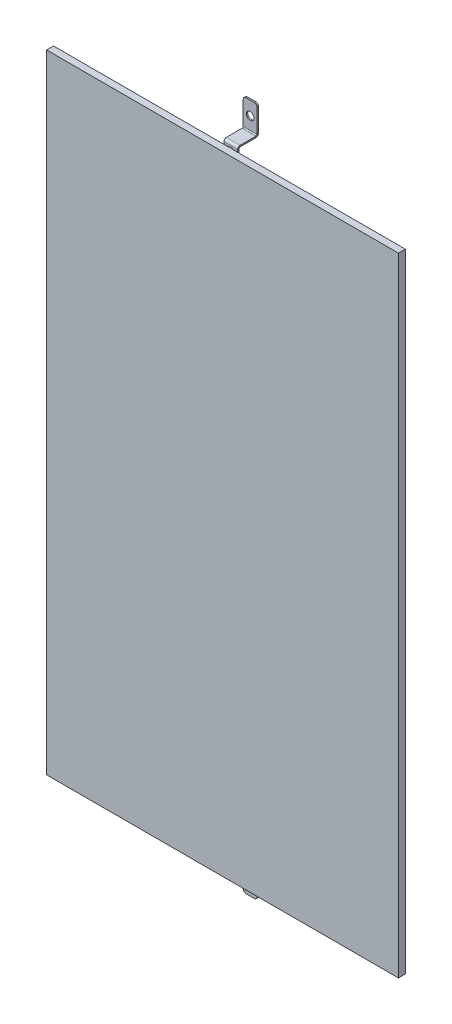
from build123d import *
from build123d.topology import SkipClean

# Parameters (mm, degrees)
SKETCH1_W           = 255
SKETCH1_H           = 455
BOSS_EXTRUDE1_DEPTH = 5
SKETCH2_R           = 2.75
BASE_FLANGE1_DEPTH  = 1
JOG1_START          = 145
JOG1_DEPTH          = 10
JOG1_START_2        = 147
JOG1_2_DEPTH        = 6
JOG1_START_3        = -7.7366
JOG1_3_DEPTH        = 1.716372919
JOG1_START_4        = -20
JOG1_4_OUTLINE_W    = 2
JOG1_4_OUTLINE_H    = 1
JOG1_4_DEPTH        = 12.381759831
JOG1_START_5        = -7
JOG1_5_DEPTH        = 1
JOG1_6_DEPTH        = 10
JOG1_7_DEPTH        = 10
SKETCH8_R           = 4
BOSS_EXTRUDE2_DEPTH = 1


with BuildPart() as part:
    # Sketch1 → Boss-Extrude1 (new body)
    with BuildSketch(Plane.XY):
        with Locations((150, 250)):
            Rectangle(SKETCH1_W, SKETCH1_H)
    extrude(amount=-BOSS_EXTRUDE1_DEPTH)


with BuildPart() as body_2:
    # Base-Flange1: sheet metal written as solids
    # Sketch2 → Base-Flange1 (new body)
    with BuildSketch(Plane(origin=(0, 0, -21), x_dir=(-1, 0, 0), z_dir=(0, 0, -1))):
        with BuildLine():
            Line((-153, 0.18), (-147, 0.18))
            ThreePointArc((-147, 0.18), (-145.585786438, 0.765786438), (-145, 2.18))
            Line((-145, 2.18), (-145, 32.18))
            ThreePointArc((-145, 32.18), (-145.585786438, 33.594213562), (-147, 34.18))
            Line((-147, 34.18), (-153, 34.18))
            ThreePointArc((-153, 34.18), (-154.414213562, 33.594213562), (-155, 32.18))
            Line((-155, 32.18), (-155, 2.18))
            ThreePointArc((-155, 2.18), (-154.414213562, 0.765786438), (-153, 0.18))
        make_face()
        with Locations((-150, 10.18)):
            Circle(SKETCH2_R, mode=Mode.SUBTRACT)
    extrude(amount=-BASE_FLANGE1_DEPTH)

    # Jog1: read off the stored shape, not the designer's step
    # Jog1 outline → Jog1 (cut)
    with BuildSketch(Plane.YZ.offset(JOG1_START)):
        with BuildLine():
            Line((34.18, -20), (20.781417721, -20))
            ThreePointArc((20.781417721, -20), (20.140602795, -20.728828115), (19.208776631, -21))
            Line((19.208776631, -21), (34.18, -21))
            Line((34.18, -21), (34.18, -20))
        make_face()
    extrude(amount=JOG1_DEPTH, mode=Mode.SUBTRACT)

    # Jog1 2 outline → Jog1 2 (add)
    with BuildSketch(Plane.YZ.offset(JOG1_START_2)):
        with BuildLine():
            ThreePointArc((20.781417721, -20), (20.903891388, -19.640713558), (20.945376631, -19.2634))
            Line((20.945376631, -19.2634), (20.945376631, -7.7366))
            ThreePointArc((20.945376631, -7.7366), (21.161121776, -7.215745145), (21.681976631, -7))
            Line((21.681976631, -7), (34.18, -7))
            Line((34.18, -7), (34.18, -6))
            Line((34.18, -6), (21.681976631, -6))
            ThreePointArc((21.681976631, -6), (20.454014995, -6.508638364), (19.945376631, -7.7366))
            Line((19.945376631, -7.7366), (19.945376631, -19.2634))
            ThreePointArc((19.945376631, -19.2634), (19.729631486, -19.784254855), (19.208776631, -20))
            Line((19.208776631, -20), (20.781417721, -20))
        make_face()
    extrude(amount=JOG1_2_DEPTH)

    # Jog1 3 outline → Jog1 3 (add)
    with BuildSketch(Plane.XY.offset(JOG1_START_3)):
        with BuildLine():
            Line((155, 19.945376631), (155, 32.18))
            ThreePointArc((155, 32.18), (154.414213562, 33.594213562), (153, 34.18))
            Line((153, 34.18), (153, 19.945376631))
            Line((153, 19.945376631), (155, 19.945376631))
        make_face()
        with BuildLine():
            Line((147, 19.945376631), (147, 34.18))
            ThreePointArc((147, 34.18), (145.585786438, 33.594213562), (145, 32.18))
            Line((145, 32.18), (145, 19.945376631))
            Line((145, 19.945376631), (147, 19.945376631))
        make_face()
    extrude(amount=JOG1_3_DEPTH)

    # Jog1 4 outline → Jog1 4 (add)
    with BuildSketch(Plane.XY.offset(JOG1_START_4)):
        with Locations((154, 20.445376631)):
            Rectangle(JOG1_4_OUTLINE_W, JOG1_4_OUTLINE_H)
        with Locations((146, 20.445376631)):
            Rectangle(JOG1_4_OUTLINE_W, JOG1_4_OUTLINE_H)
    extrude(amount=JOG1_4_DEPTH)

    # Jog1 5 outline → Jog1 5 (add)
    with BuildSketch(Plane.XY.offset(JOG1_START_5)):
        with BuildLine():
            Line((153, 20.945376631), (155, 20.945376631))
            Line((155, 20.945376631), (155, 32.18))
            ThreePointArc((155, 32.18), (154.414213562, 33.594213562), (153, 34.18))
            Line((153, 34.18), (153, 20.945376631))
        make_face()
        with BuildLine():
            Line((145, 20.945376631), (147, 20.945376631))
            Line((147, 20.945376631), (147, 34.18))
            ThreePointArc((147, 34.18), (145.585786438, 33.594213562), (145, 32.18))
            Line((145, 32.18), (145, 20.945376631))
        make_face()
    extrude(amount=JOG1_5_DEPTH)

    # Jog1 6 outline → Jog1 6 (cut)
    with SkipClean():  # the faces are left unmerged after this step: merging them gives an invalid solid
        with BuildSketch(Plane.YZ.offset(JOG1_START)):
            with BuildLine():
                Line((19.945376631, -6.020227081), (19.945376631, -7.7366))
                ThreePointArc((19.945376631, -7.7366), (20.454014995, -6.508638364), (21.681976631, -6))
                Line((21.681976631, -6), (36, -5.999999994))
                Line((36, -5.999999994), (36, -5))
                Line((36, -5), (20.945376637, -5))
                Line((20.945376637, -5), (20.945376637, -6))
                Line((20.945376637, -6), (20.945376631, -6.020227081))
                Line((20.945376631, -6.020227081), (19.945376631, -6.020227081))
            make_face()
            with BuildLine():
                ThreePointArc((20.781417721, -20), (20.436738266, -20.491361637), (19.945376629, -20.836041092))
                Line((19.945376629, -20.836041092), (19.945376626, -21))
                Line((19.945376626, -21), (36, -21))
                Line((36, -21), (36, -7))
                Line((36, -7), (21.681976631, -7))
                ThreePointArc((21.681976631, -7), (21.161121776, -7.215745145), (20.945376631, -7.7366))
                Line((20.945376631, -7.7366), (20.945376631, -19.2634))
                ThreePointArc((20.945376631, -19.2634), (20.903891388, -19.640713558), (20.781417721, -20))
            make_face()
        extrude(amount=JOG1_6_DEPTH, mode=Mode.SUBTRACT)
    add(body_2.part.scale(1), mode=Mode.REPLACE)  # the faces are merged on a copy

    # Jog1 7 outline → Jog1 7 (add)
    with BuildSketch(Plane.YZ.offset(JOG1_START)):
        with BuildLine():
            Line((19.945376631, -20), (19.945376631, -19.2634))
            ThreePointArc((19.945376631, -19.2634), (19.729631486, -19.784254855), (19.208776631, -20))
            Line((19.208776631, -20), (18, -20))
            Line((18, -20), (18, -21))
            Line((18, -21), (19.208776631, -21))
            ThreePointArc((19.208776631, -21), (19.586090188, -20.958514757), (19.945376629, -20.836041092))
            Line((19.945376629, -20.836041092), (19.945376631, -20))
        make_face()
    extrude(amount=JOG1_7_DEPTH)


with BuildPart() as body_3:
    # Sketch8 → Boss-Extrude2 (new body)
    with BuildSketch(Plane.XY.offset(-6)):
        with Locations((150, 26.930988316)):
            Circle(SKETCH8_R)
    extrude(amount=BOSS_EXTRUDE2_DEPTH)


with BuildPart() as body_4:
    # Mirror1: mirrored copy
    add(body_2.part.mirror(Plane.ZX.offset(250)))


with BuildPart() as body_5:
    # Mirror1 2: mirrored copy
    add(body_3.part.mirror(Plane.ZX.offset(250)))


solid = Compound([part.part, body_2.part, body_3.part, body_4.part, body_5.part])
